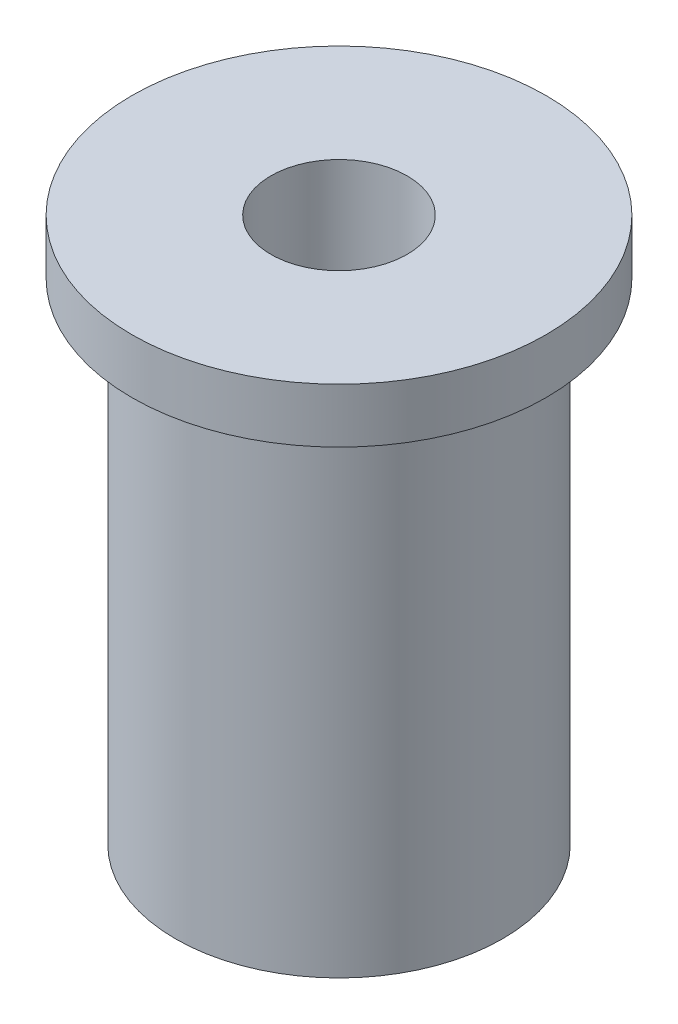
from build123d import *


with BuildPart() as part:
    # Sketch1 → Revolve1 (revolve)
    with BuildSketch(Plane(origin=(0, 0, 0), x_dir=(0, 0, -1), z_dir=(1, 0, 0))):
        Polygon((1.25, 0), (1.25, 10), (3.8, 10), (3.8, 9), (3, 9), (3, 0), align=None)
    revolve(axis=Axis((0, 0, 0), (0, 1, 0)))


solid = part.part
